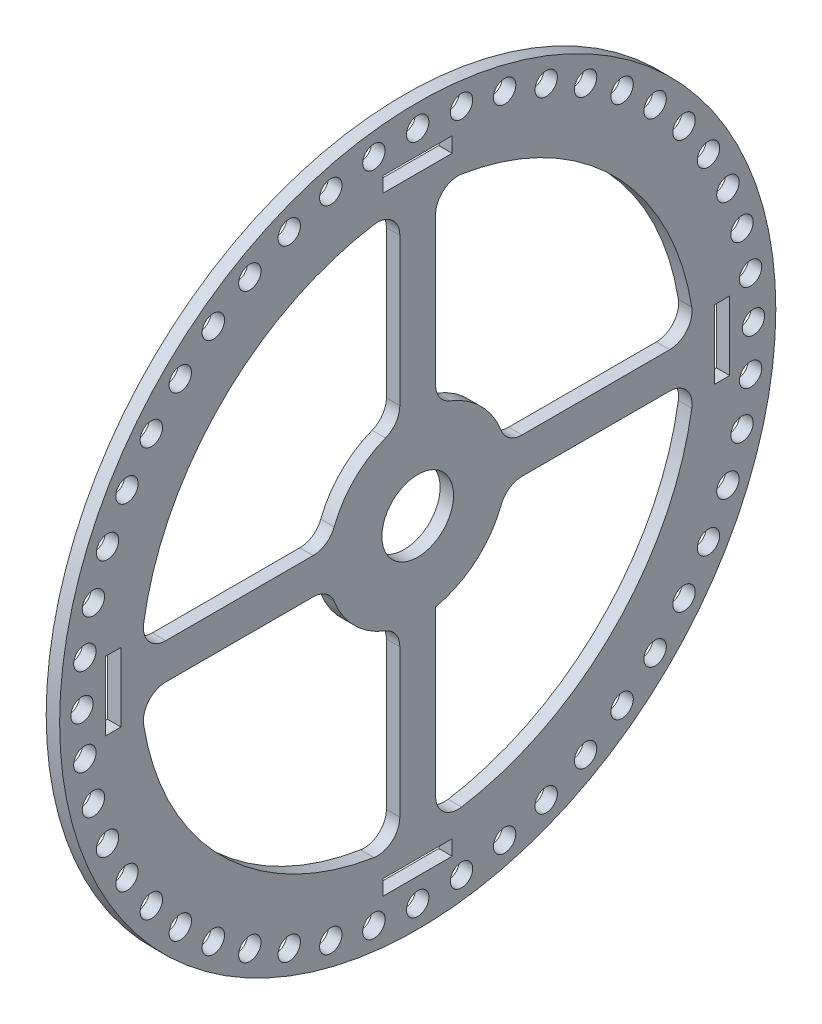
from build123d import *

# Parameters (mm, degrees)
SKETCH3_R           = 40
SKETCH3_R_2         = 4
SKETCH3_W           = 7.7
SKETCH3_H           = 1.7
SKETCH3_W_2         = 1.7
SKETCH3_H_2         = 7.7
BOSS_EXTRUDE2_DEPTH = 1.5
SKETCH4_R           = 1.25
CUT_EXTRUDE1_DEPTH  = 1.5
CIRPATTERN1_COUNT   = 48
FILLET1_R           = 2.5


with BuildPart() as part:
    # Sketch3 → Boss-Extrude2 (new body)
    with BuildSketch(Plane(origin=(0, 0, 0), x_dir=(0, 0, -1), z_dir=(1, 0, 0))):
        Circle(SKETCH3_R)
        Circle(SKETCH3_R_2, mode=Mode.SUBTRACT)
        with BuildLine():
            Line((9.797958971, 2), (30.935416597, 2))
            ThreePointArc((30.935416597, 2), (21.920310217, 21.920310217), (2, 30.935416597))
            Line((2, 30.935416597), (2, 9.797958971))
            ThreePointArc((2, 9.797958971), (7.071067812, 7.071067812), (9.797958971, 2))
        make_face(mode=Mode.SUBTRACT)
        with BuildLine():
            Line((-30.935416597, 2), (-9.797958971, 2))
            ThreePointArc((-9.797958971, 2), (-7.071067812, 7.071067812), (-2, 9.797958971))
            Line((-2, 9.797958971), (-2, 30.935416597))
            ThreePointArc((-2, 30.935416597), (-21.920310217, 21.920310217), (-30.935416597, 2))
        make_face(mode=Mode.SUBTRACT)
        with BuildLine():
            Line((-30.935416597, -2), (-9.797958971, -2))
            ThreePointArc((-9.797958971, -2), (-7.071067812, -7.071067812), (-2, -9.797958971))
            Line((-2, -9.797958971), (-2, -30.935416597))
            ThreePointArc((-2, -30.935416597), (-21.920310217, -21.920310217), (-30.935416597, -2))
        make_face(mode=Mode.SUBTRACT)
        with BuildLine():
            Line((9.797958971, -2), (30.935416597, -2))
            ThreePointArc((30.935416597, -2), (21.920310217, -21.920310217), (2, -30.935416597))
            Line((2, -30.935416597), (2, -9.797958971))
            ThreePointArc((2, -9.797958971), (7.071067812, -7.071067812), (9.797958971, -2))
        make_face(mode=Mode.SUBTRACT)
        with Locations((0, 34)):
            Rectangle(SKETCH3_W, SKETCH3_H, mode=Mode.SUBTRACT)
        with Locations((34, 0)):
            Rectangle(SKETCH3_W_2, SKETCH3_H_2, mode=Mode.SUBTRACT)
        with Locations((0, -34)):
            Rectangle(SKETCH3_W, SKETCH3_H, mode=Mode.SUBTRACT)
        with Locations((-34, 0)):
            Rectangle(SKETCH3_W_2, SKETCH3_H_2, mode=Mode.SUBTRACT)
    extrude(amount=BOSS_EXTRUDE2_DEPTH)

    # Sketch4 → Cut-Extrude1 (cut)
    with BuildSketch(Plane.ZY):
        with Locations((0, 37.5)):
            Circle(SKETCH4_R)
    cut_extrude1 = extrude(amount=-CUT_EXTRUDE1_DEPTH, mode=Mode.SUBTRACT)

    # CirPattern1: Cut-Extrude1 ×48 about axis
    cirpattern1_axis = Axis((0, 0, 0), (1, 0, 0))
    for i in range(1, CIRPATTERN1_COUNT):
        add(cut_extrude1.rotate(cirpattern1_axis, i * 360 / CIRPATTERN1_COUNT), mode=Mode.SUBTRACT)

    # Fillet1
    fillet1_edges = [part.edges().sort_by_distance(p)[0] for p in [
        (0.75, -2, 30.935416597),
        (0.75, -30.935416597, 2),
        (0.75, -9.797958971, 2),
        (0.75, -2, 9.797958971),
        (0.75, -30.935416597, -2),
        (0.75, -2, -30.935416597),
        (0.75, 2, -9.797958971),
        (0.75, 2, -30.935416597),
        (0.75, 2, 9.797958971),
        (0.75, 2, 30.935416597),
        (0.75, 9.797958971, 2),
        (0.75, 30.935416597, 2),
        (0.75, 9.797958971, -2),
        (0.75, 30.935416597, -2),
        (0.75, -2, -9.797958971),
    ]]
    fillet(fillet1_edges, radius=FILLET1_R)


solid = part.part
